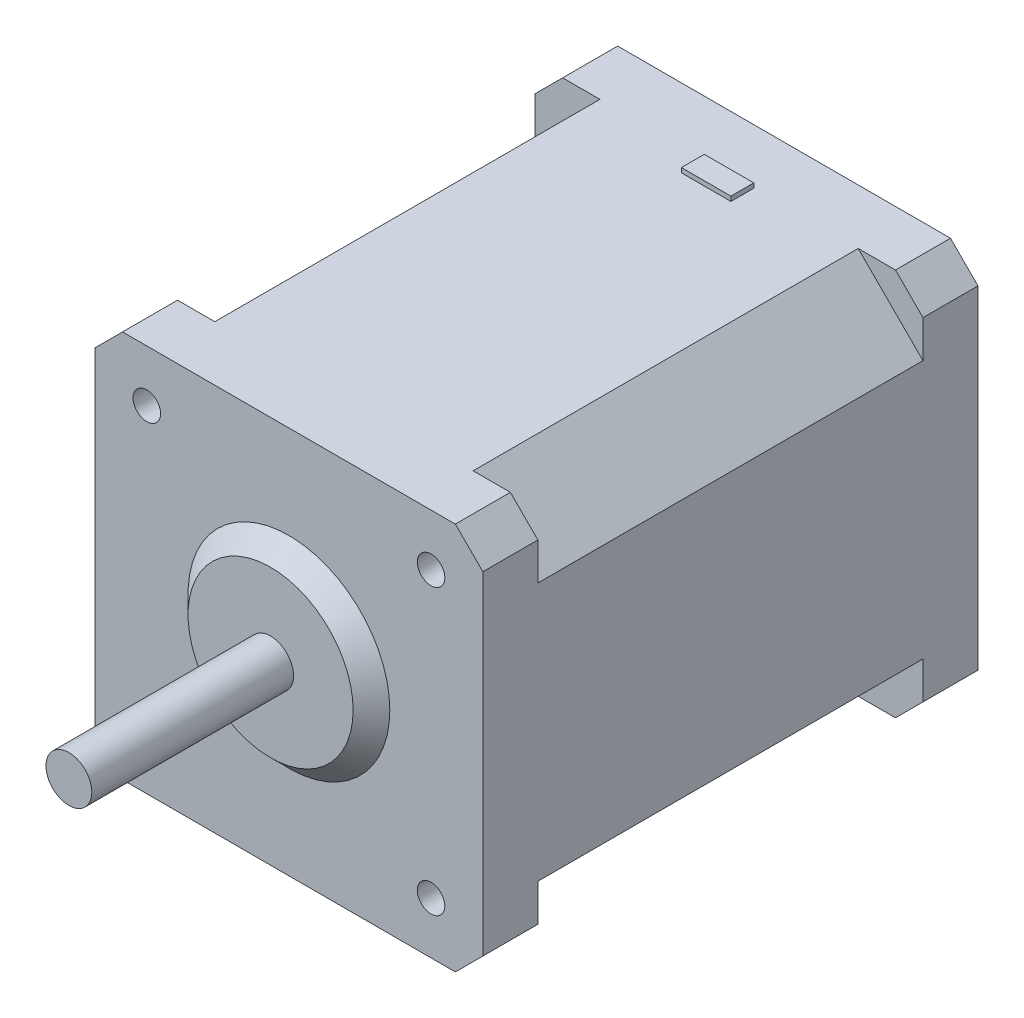
from build123d import *

# Parameters (mm, degrees)
SKETCH_1_W          = 42.3
SKETCH_1_H          = 42.3
SKETCH_1_R          = 1.5
EXTRUDE_1_DEPTH     = 6
EXTRUDE_2_DEPTH     = 42
SKETCH_3_W          = 42.3
SKETCH_3_H          = 42.3
EXTRUDE_3_DEPTH     = 6
SKETCH_4_R          = 2.5
EXTRUDE_4_DEPTH     = 24
SKETCH_4_3_R        = 11
SKETCH_4_3_R_2      = 2.5
EXTRUDE_5_DEPTH     = 2
CHAMFER_1_SIZE      = 3
CUT_EXTRUDE_START   = -6
SKETCH_5_R          = 1.5
CUT_EXTRUDE_1_DEPTH = 6
SKETCH_6_W          = 5.398834963
SKETCH_6_H          = 2.5
EXTRUDE_6_DEPTH     = 0.5
CHAMFER_2_SIZE      = 2


with BuildPart() as part:
    # 草图1 → 凸台-拉伸1 (new body)
    with BuildSketch(Plane.XY):
        with Locations((-2.012033722, 2.221867738)):
            Rectangle(SKETCH_1_W, SKETCH_1_H)
        with Locations((-17.512033722, 17.721867738)):
            Circle(SKETCH_1_R, mode=Mode.SUBTRACT)
        with Locations((13.487966278, 17.721867738)):
            Circle(SKETCH_1_R, mode=Mode.SUBTRACT)
        with Locations((-17.512033722, -13.278132262)):
            Circle(SKETCH_1_R, mode=Mode.SUBTRACT)
        with Locations((13.487966278, -13.278132262)):
            Circle(SKETCH_1_R, mode=Mode.SUBTRACT)
    extrude(amount=EXTRUDE_1_DEPTH)

    # 草图2 → 凸台-拉伸2 (add)
    with BuildSketch(Plane.XY.offset(6)):
        Polygon((-16.804926941, -18.221025481), (-22.454926941, -12.571025481), (-23.162033722, -11.8639187), (-23.162033722, 16.307654175), (-22.454926941, 17.014760956), (-16.804926941, 22.664760956), (-16.09782016, 23.371867738), (12.073752715, 23.371867738), (12.780859496, 22.664760956), (18.430859496, 17.014760956), (19.137966278, 16.307654175), (19.137966278, -11.8639187), (18.430859496, -12.571025481), (12.780859496, -18.221025481), (12.073752715, -18.928132262), (-16.09782016, -18.928132262), align=None)
    extrude(amount=EXTRUDE_2_DEPTH)

    # 草图3 → 凸台-拉伸3 (add)
    with BuildSketch(Plane.XY.offset(48)):
        with Locations((-2.012033722, 2.221867738)):
            Rectangle(SKETCH_3_W, SKETCH_3_H)
    extrude(amount=EXTRUDE_3_DEPTH)

    # 草图4 → 凸台-拉伸4 (add)
    with BuildSketch(Plane.XY.offset(54)):
        with Locations((-2.012033722, 2.221867738)):
            Circle(SKETCH_4_R)
    extrude(amount=EXTRUDE_4_DEPTH)

    # 草图4<3> → 凸台-拉伸5 (add)
    with BuildSketch(Plane.XY.offset(54)):
        with Locations((-2.012033722, 2.221867738)):
            Circle(SKETCH_4_3_R)
        with Locations((-2.012033722, 2.221867738)):
            Circle(SKETCH_4_3_R_2, mode=Mode.SUBTRACT)
    extrude(amount=EXTRUDE_5_DEPTH)

    # 倒角1
    chamfer_1_edges = [part.edges().sort_by_distance(p)[0] for p in [
        (-23.162033722, -18.928132262, 51),
        (-23.162033722, -18.928132262, 3),
        (19.137966278, -18.928132262, 51),
        (19.137966278, -18.928132262, 3),
        (19.137966278, 23.371867738, 51),
        (19.137966278, 23.371867738, 3),
        (-23.162033722, 23.371867738, 51),
        (-23.162033722, 23.371867738, 3),
    ]]
    chamfer(chamfer_1_edges, length=CHAMFER_1_SIZE)

    # 草图5 → 切除-拉伸1 (cut)
    with BuildSketch(Plane.XY.offset(54).offset(CUT_EXTRUDE_START)):
        with Locations((-17.512033722, 17.721867738)):
            Circle(SKETCH_5_R)
        with Locations((13.487966278, 17.721867738)):
            Circle(SKETCH_5_R)
        with Locations((13.487966278, -13.278132262)):
            Circle(SKETCH_5_R)
        with Locations((-17.512033722, -13.278132262)):
            Circle(SKETCH_5_R)
    extrude(amount=CUT_EXTRUDE_1_DEPTH, mode=Mode.SUBTRACT)

    # 草图6 → 凸台-拉伸6 (add)
    with BuildSketch(Plane(origin=(0, 23.371867738, 0), x_dir=(1, 0, 0), z_dir=(0, 1, 0))):
        with Locations((-2.012033723, -7.25)):
            Rectangle(SKETCH_6_W, SKETCH_6_H)
    extrude(amount=EXTRUDE_6_DEPTH)

    # 倒角2
    chamfer_2_edges = [part.edges().sort_by_distance(p)[0] for p in [
        (-13.012033722, 2.221867738, 56),
    ]]
    chamfer(chamfer_2_edges, length=CHAMFER_2_SIZE - 0.0001)  # a hair under: the kernel refuses the full size


solid = part.part
